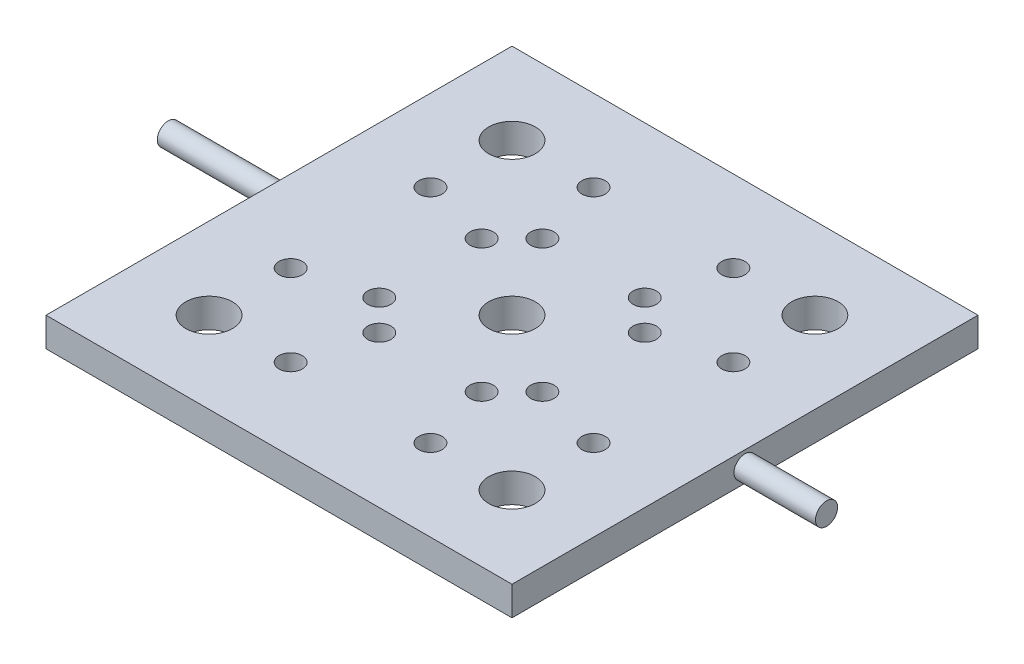
from build123d import *

# Parameters (mm, degrees)
SKETCH1_W           = 50.8
SKETCH1_H           = 50.8
BOSS_EXTRUDE1_DEPTH = 1.5875
SKETCH3_R           = 1.2065
BOSS_EXTRUDE2_DEPTH = 8.89
SKETCH4_R           = 2.54
SKETCH4_R_2         = 1.27
CUT_EXTRUDE1_DEPTH  = 43.790708396
BOSS_EXTRUDE3_START = 12.065
SKETCH5_R           = 1.2065
BOSS_EXTRUDE3_DEPTH = 12.065


with BuildPart() as part:
    # Sketch1 → Boss-Extrude1 (new, symmetric)
    with BuildSketch(Plane(origin=(0, 0, 0), x_dir=(1, 0, 0), z_dir=(0, 1, 0))):
        Rectangle(SKETCH1_W, SKETCH1_H)
    extrude(amount=BOSS_EXTRUDE1_DEPTH, both=True)

    # Sketch3 → Boss-Extrude2 (add)
    with BuildSketch(Plane(origin=(25.4, 0, 0), x_dir=(0, 0, -1), z_dir=(1, 0, 0))):
        Circle(SKETCH3_R)
    extrude(amount=BOSS_EXTRUDE2_DEPTH)

    # Sketch4 → Cut-Extrude1 (cut, through all)
    with BuildSketch(Plane(origin=(0, 1.5875, 0), x_dir=(1, 0, 0), z_dir=(0, 1, 0))):
        Circle(SKETCH4_R)
        with Locations((-16.51, 16.51)):
            Circle(SKETCH4_R)
        with Locations((16.51, 16.51)):
            Circle(SKETCH4_R)
        with Locations((16.51, -16.51)):
            Circle(SKETCH4_R)
        with Locations((-16.51, -16.51)):
            Circle(SKETCH4_R)
        with Locations((-16.51, 7.62)):
            Circle(SKETCH4_R_2)
        with Locations((-7.62, 16.51)):
            Circle(SKETCH4_R_2)
        with Locations((7.62, 16.51)):
            Circle(SKETCH4_R_2)
        with Locations((-16.51, -7.62)):
            Circle(SKETCH4_R_2)
        with Locations((7.62, -16.51)):
            Circle(SKETCH4_R_2)
        with Locations((-7.62, -16.51)):
            Circle(SKETCH4_R_2)
        with Locations((16.51, -7.62)):
            Circle(SKETCH4_R_2)
        with Locations((16.51, 7.62)):
            Circle(SKETCH4_R_2)
        with Locations((5.578227154, 8.89)):
            Circle(SKETCH4_R_2)
        with Locations((-5.578227154, 8.89)):
            Circle(SKETCH4_R_2)
        with Locations((8.89, -5.578227154)):
            Circle(SKETCH4_R_2)
        with Locations((8.89, 5.578227154)):
            Circle(SKETCH4_R_2)
        with Locations((-5.578227154, -8.89)):
            Circle(SKETCH4_R_2)
        with Locations((5.578227154, -8.89)):
            Circle(SKETCH4_R_2)
        with Locations((-8.89, 5.578227154)):
            Circle(SKETCH4_R_2)
        with Locations((-8.89, -5.578227154)):
            Circle(SKETCH4_R_2)
    extrude(amount=-CUT_EXTRUDE1_DEPTH, mode=Mode.SUBTRACT)

    # Sketch5 → Boss-Extrude3 (add)
    with BuildSketch(Plane.ZY.offset(25.4).offset(BOSS_EXTRUDE3_START)):
        Circle(SKETCH5_R)
    extrude(amount=-BOSS_EXTRUDE3_DEPTH)


solid = part.part
